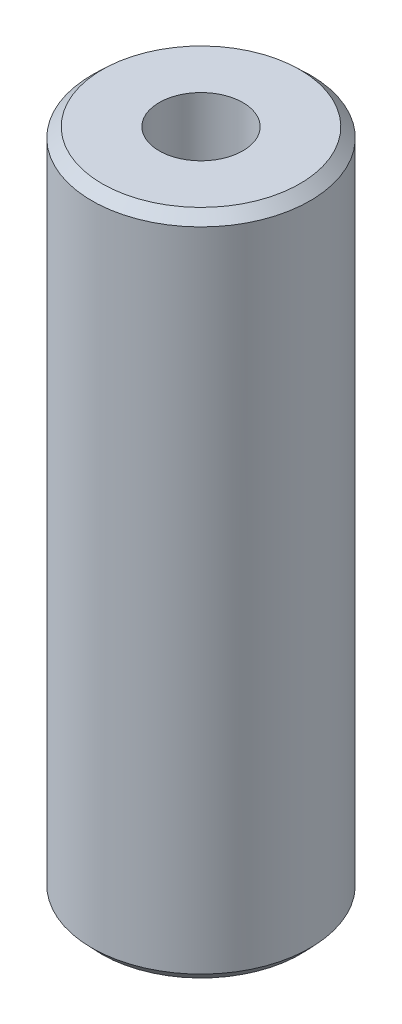
from build123d import *
from OCP.BRepFilletAPI import BRepFilletAPI_MakeChamfer

# Parameters (mm, degrees)
SKETCH1_R           = 37.5
BOSS_EXTRUDE1_DEPTH = 229.295878648
SKETCH2_R           = 14.3911335
CUT_EXTRUDE1_DEPTH  = 236.348889874
CHAMFER1_SIZE       = 3.328565002
CHAMFER1_SIZE2      = 3.512805031


with BuildPart() as part:
    # Sketch1 → Boss-Extrude1 (new body)
    with BuildSketch(Plane(origin=(0, 0, 0), x_dir=(1, 0, 0), z_dir=(0, 1, 0))):
        Circle(SKETCH1_R)
    extrude(amount=BOSS_EXTRUDE1_DEPTH)

    # Sketch2 → Cut-Extrude1 (cut, through all)
    with BuildSketch(Plane(origin=(0, 0, 0), x_dir=(1, 0, 0), z_dir=(0, 1, 0))):
        Circle(SKETCH2_R)
    extrude(amount=CUT_EXTRUDE1_DEPTH, mode=Mode.SUBTRACT)

    # Chamfer1: one chamfer whose edges measure the first distance from different faces: ONE call of the kernel's chamfer builder (chamfer() names one face for all edges)
    chamfer1_edges_1 = [part.edges().sort_by_distance(p)[0] for p in [
        (-37.5, 229.295878648, 0),
    ]]
    chamfer1_side_1 = [part.faces().sort_by_distance(p)[0] for p in [
        (-37.5, 114.647939324, 0),
    ]]
    chamfer1_edges_2 = [part.edges().sort_by_distance(p)[0] for p in [
        (-37.5, 0, 0),
    ]]
    chamfer1_side_2 = [part.faces().sort_by_distance(p)[0] for p in [
        (-36.439339828, 0, 0),
    ]]
    chamfer1 = BRepFilletAPI_MakeChamfer(part.part.solid().wrapped)
    for e in chamfer1_edges_1:
        chamfer1.Add(CHAMFER1_SIZE, CHAMFER1_SIZE2, e.wrapped, chamfer1_side_1[0].wrapped)  # the first distance lies on this face
    for e in chamfer1_edges_2:
        chamfer1.Add(CHAMFER1_SIZE, CHAMFER1_SIZE2, e.wrapped, chamfer1_side_2[0].wrapped)  # the first distance lies on this face
    add(Compound.cast(chamfer1.Shape()), mode=Mode.REPLACE)


solid = part.part
